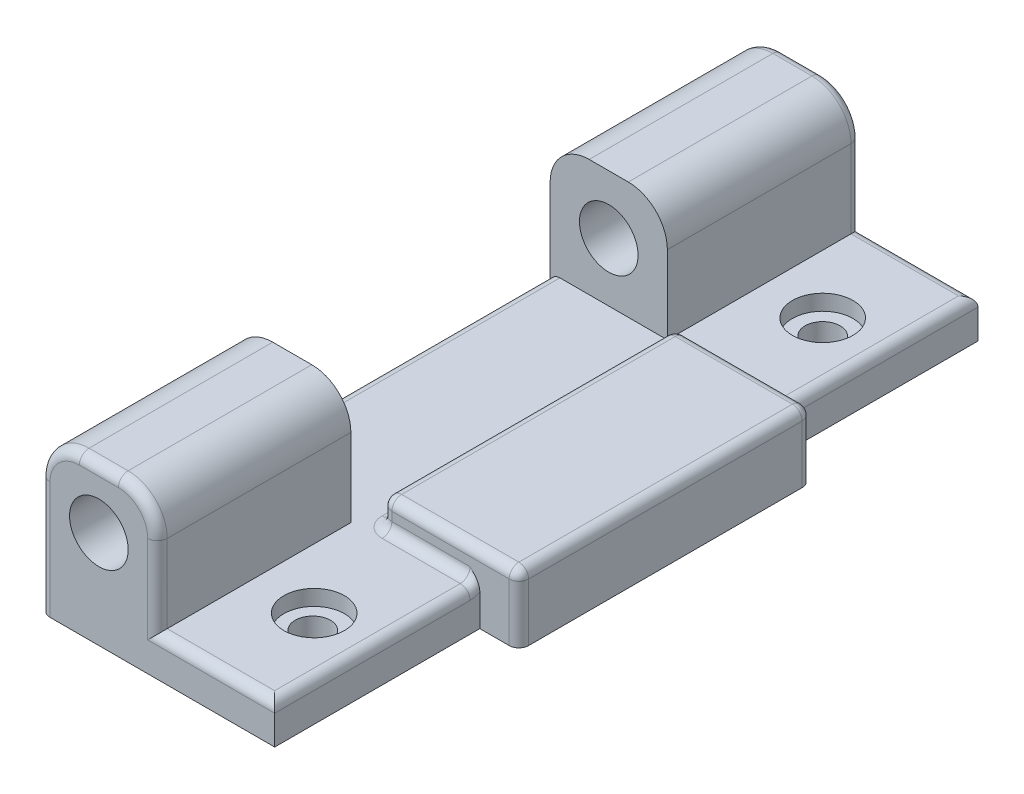
from build123d import *

# Parameters (mm, degrees)
SKETCH2_W             = 12
SKETCH2_H             = 36
BOSS_EXTRUDE1_DEPTH   = 2
SKETCH3_W             = 6
SKETCH3_H             = 9.9
BOSS_EXTRUDE2_DEPTH   = 6
F_3_0MM_DOWEL_HOLE1_D = 3
FILLET1_R             = 2
SKETCH10_W            = 15
SKETCH10_H            = 2
BOSS_EXTRUDE3_DEPTH   = 2
SKETCH11_W            = 7
SKETCH11_H            = 15
BOSS_EXTRUDE4_DEPTH   = 1.45
FILLET2_R             = 0.5
FILLET5_R             = 0.5
FILLET6_R             = 0.5
SKETCH7_R             = 0.9
CUT_EXTRUDE5_DEPTH    = 62.182196999
SKETCH19_R            = 1.55
CUT_EXTRUDE6_DEPTH    = 0.8
FILLET7_R             = 0.5


with BuildPart() as part:
    # Sketch2 → Boss-Extrude1 (new body)
    with BuildSketch(Plane(origin=(0, 0, 0), x_dir=(1, 0, 0), z_dir=(0, 1, 0))):
        with Locations((-48.387350108, 9.372931481)):
            Rectangle(SKETCH2_W, SKETCH2_H)
    extrude(amount=BOSS_EXTRUDE1_DEPTH)

    # Sketch3 → Boss-Extrude2 (add)
    with BuildSketch(Plane(origin=(0, 2, 0), x_dir=(1, 0, 0), z_dir=(0, 1, 0))):
        with Locations((-51.387350108, -3.677068519)):
            Rectangle(SKETCH3_W, SKETCH3_H)
        with Locations((-51.387350108, 22.422931481)):
            Rectangle(SKETCH3_W, SKETCH3_H)
    extrude(amount=BOSS_EXTRUDE2_DEPTH)

    # Ø3.0mm Dowel Hole1 (through all)
    with Locations(Plane(origin=(0, 0, -27.372931481), x_dir=(-1, 0, 0), z_dir=(0, 0, -1))):
        with Locations((51.387350108, 5)):
            Hole(F_3_0MM_DOWEL_HOLE1_D / 2)

    # Fillet1
    fillet1_edges = [part.edges().sort_by_distance(p)[0] for p in [
        (-54.387350108, 8, 3.677068519),
        (-48.387350108, 8, 3.677068519),
        (-54.387350108, 8, -22.422931481),
        (-48.387350108, 8, -22.422931481),
    ]]
    fillet(fillet1_edges, radius=FILLET1_R)

    # Sketch10 → Boss-Extrude3 (add)
    with BuildSketch(Plane(origin=(-42.387350108, 0, 0), x_dir=(0, 0, -1), z_dir=(1, 0, 0))):
        with Locations((9.372931481, 1)):
            Rectangle(SKETCH10_W, SKETCH10_H)
    extrude(amount=BOSS_EXTRUDE3_DEPTH)

    # Sketch11 → Boss-Extrude4 (add)
    with BuildSketch(Plane(origin=(0, 2, 0), x_dir=(1, 0, 0), z_dir=(0, 1, 0))):
        with Locations((-43.887350108, 9.372931481)):
            Rectangle(SKETCH11_W, SKETCH11_H)
    extrude(amount=BOSS_EXTRUDE4_DEPTH)

    # Fillet2
    fillet2_edges = [part.edges().sort_by_distance(p)[0] for p in [
        (-40.387350108, 1.725, -1.872931481),
        (-40.387350108, 1.725, -16.872931481),
        (-43.887350108, 3.45, -16.872931481),
        (-43.887350108, 3.45, -1.872931481),
    ]]
    fillet(fillet2_edges, radius=FILLET2_R)

    # Fillet5
    # the kernel refuses this fillet: 0.5 mm, written as the material it takes off along each edge
    with BuildSketch(Plane(origin=(-40.887350108, 2.95, -16.372931481), x_dir=(0, 1, 0), z_dir=(1, 0, 0))) as fillet5_piece_1_section:
        Polygon((0, 0), (FILLET5_R, 0), (FILLET5_R, -FILLET5_R), (0, -FILLET5_R), align=None)
    fillet5_piece_1 = extrude(amount=FILLET5_R, mode=Mode.PRIVATE)
    fillet5_piece_1 = fillet5_piece_1 - Plane(origin=(-40.887350108, 2.95, -16.372931481), x_dir=(0, -0.7071067811865475, 0.7071067811865475), z_dir=(1, 0, 0)) * Sphere(FILLET5_R, mode=Mode.PRIVATE)
    add(fillet5_piece_1, mode=Mode.SUBTRACT)
    with BuildSketch(Plane(origin=(-40.887350108, 2.95, -2.372931481), x_dir=(0, 1, 0), z_dir=(1, 0, 0))) as fillet5_piece_2_section:
        Polygon((0, 0), (FILLET5_R, 0), (FILLET5_R, FILLET5_R), (0, FILLET5_R), align=None)
    fillet5_piece_2 = extrude(amount=FILLET5_R, mode=Mode.PRIVATE)
    fillet5_piece_2 = fillet5_piece_2 - Plane(origin=(-40.887350108, 2.95, -2.372931481), x_dir=(0, -0.7071067811865477, -0.7071067811865474), z_dir=(1, 0, 0)) * Sphere(FILLET5_R, mode=Mode.PRIVATE)
    add(fillet5_piece_2, mode=Mode.SUBTRACT)
    with BuildSketch(Plane(origin=(-40.387350108, 3.45, -16.372931481), x_dir=(0, -1, 0), z_dir=(0, 0, 1))) as fillet5_piece_3:
        with BuildLine():
            CenterArc((FILLET5_R, -FILLET5_R), FILLET5_R, 90, 90)
            Line((0, -FILLET5_R), (0, 0))
            Line((0, 0), (FILLET5_R, 0))
        make_face()
    extrude(amount=14, mode=Mode.SUBTRACT)

    # Fillet6
    fillet6_edges = [part.edges().sort_by_distance(p)[0] for p in [
        (-47.387350108, 2.475, -16.872931481),
        (-47.387350108, 2.475, -1.872931481),
        (-47.387350108, 3.45, -9.372931481),
        (-47.387350108, 3.303553391, -2.01937809),
        (-47.387350108, 3.303553391, -16.726484871),
        (-44.887350108, 2, -16.872931481),
        (-47.387350108, 2, -9.372931481),
        (-44.887350108, 2, -1.872931481),
    ]]
    fillet(fillet6_edges, radius=FILLET6_R)

    # Sketch7 → Cut-Extrude5 (cut, through all)
    with BuildSketch(Plane(origin=(0, 2, 0), x_dir=(1, 0, 0), z_dir=(0, 1, 0))):
        with Locations(Location((-45.387350108, -3.677068519, 0), (0, 0, 270))):
            Circle(SKETCH7_R)
        with Locations(Location((-45.387350108, 22.422931481, 0), (0, 0, 270))):
            Circle(SKETCH7_R)
    extrude(amount=-CUT_EXTRUDE5_DEPTH, mode=Mode.SUBTRACT)

    # Sketch19 → Cut-Extrude6 (cut)
    with BuildSketch(Plane(origin=(0, 2, 0), x_dir=(1, 0, 0), z_dir=(0, 1, 0))):
        with Locations(Location((-45.316328349, -3.677068519, 0), (0, 0, 270))):
            Circle(SKETCH19_R)
        with Locations(Location((-45.387350108, 22.422931481, 0), (0, 0, 270))):
            Circle(SKETCH19_R)
    extrude(amount=-CUT_EXTRUDE6_DEPTH, mode=Mode.SUBTRACT)

    # Fillet7
    # the kernel refuses this fillet: 0.5 mm, written as the material it takes off along each edge
    with BuildSketch(Plane(origin=(-42.387350108, 2, -1.372931481), x_dir=(0, -1, 0), z_dir=(0, 0, 1)), Plane(origin=(-42.387350108, 2, -28.622931481), x_dir=(0, -1, 0), z_dir=(0, 0, 1))) as fillet7_piece_1:
        with BuildLine():
            CenterArc((FILLET7_R, -FILLET7_R), FILLET7_R, 90, 90)
            Line((0, -FILLET7_R), (0, 0))
            Line((0, 0), (FILLET7_R, 0))
        make_face()
    extrude(amount=11.25, mode=Mode.SUBTRACT)
    with BuildSketch(Plane(origin=(-41.137350108, 2, 8.627068519), x_dir=(0, -1, 0), z_dir=(-1, 0, 0)), Plane(origin=(-48.387350108, 2, -27.372931481), x_dir=(0, -1, 0), z_dir=(1, 0, 0)), Plane(origin=(-54.387350108, -1.25, 8.627068519), x_dir=(0, 0, -1), z_dir=(0, 1, 0)), Plane(origin=(-54.387350108, -1.25, -27.372931481), x_dir=(1, 0, 0), z_dir=(0, 1, 0))) as fillet7_piece_2:
        with BuildLine():
            CenterArc((FILLET7_R, -FILLET7_R), FILLET7_R, 90, 90)
            Line((0, -FILLET7_R), (0, 0))
            Line((0, 0), (FILLET7_R, 0))
        make_face()
    extrude(amount=7.25, mode=Mode.SUBTRACT)
    with BuildSketch(Plane(origin=(-42.387350108, 2.5, -17.372931481), x_dir=(0, 0.5976672776328271, -0.8017442392976486), z_dir=(0, -0.8017442392976486, -0.5976672776328271))) as fillet7_piece_3_section:
        with BuildLine():
            CenterArc((0.5 + FILLET7_R, -FILLET7_R), FILLET7_R, 90, 90)
            Line((0.5, -FILLET7_R), (0.5, 0))
            Line((0.5, 0), (0.5 + FILLET7_R, 0))
        make_face()
    fillet7_piece_3 = revolve(axis=Axis((-42.387350108, 2.5, -17.372931481), (1, 0, 0)), revolution_arc=233.296989237, mode=Mode.PRIVATE)
    fillet7_piece_3 = split(fillet7_piece_3, bisect_by=Plane(origin=(-42.387350108, 2.5, -16.872931481), z_dir=(0, 0, -1)), keep=Keep.TOP, mode=Mode.PRIVATE)
    add(fillet7_piece_3, mode=Mode.SUBTRACT)
    with BuildSketch(Plane(origin=(-42.387350108, 2.5, -1.372931481), x_dir=(0, -1, 0), z_dir=(0, 0, 1))) as fillet7_piece_4_section:
        with BuildLine():
            CenterArc((0.5 + FILLET7_R, -FILLET7_R), FILLET7_R, 90, 90)
            Line((0.5, -FILLET7_R), (0.5, 0))
            Line((0.5, 0), (0.5 + FILLET7_R, 0))
        make_face()
    fillet7_piece_4 = revolve(axis=Axis((-42.387350108, 2.5, -1.372931481), (1, 0, 0)), revolution_arc=233.296989237, mode=Mode.PRIVATE)
    fillet7_piece_4 = split(fillet7_piece_4, bisect_by=Plane(origin=(-42.387350108, 2.5, -1.872931481), z_dir=(0, 0, 1)), keep=Keep.TOP, mode=Mode.PRIVATE)
    add(fillet7_piece_4, mode=Mode.SUBTRACT)
    with BuildSketch(Plane(origin=(-54.387350108, 2, -1.272931481), x_dir=(0, -1, 0), z_dir=(0, 0, -1))) as fillet7_piece_5:
        with BuildLine():
            CenterArc((FILLET7_R, -FILLET7_R), FILLET7_R, 90, 90)
            Line((0, -FILLET7_R), (0, 0))
            Line((0, 0), (FILLET7_R, 0))
        make_face()
    extrude(amount=16.2, mode=Mode.SUBTRACT)
    with BuildSketch(Plane(origin=(-52.387350108, 8, -27.372931481), x_dir=(0, -1, 0), z_dir=(1, 0, 0))) as fillet7_piece_6:
        with BuildLine():
            CenterArc((FILLET7_R, -FILLET7_R), FILLET7_R, 90, 90)
            Line((0, -FILLET7_R), (0, 0))
            Line((0, 0), (FILLET7_R, 0))
        make_face()
    extrude(amount=2, mode=Mode.SUBTRACT)
    with BuildSketch(Plane(origin=(-48.387350108, 2, -27.372931481), x_dir=(-1, 0, 0), z_dir=(0, 1, 0))) as fillet7_piece_7:
        with BuildLine():
            CenterArc((FILLET7_R, FILLET7_R), FILLET7_R, 180, 90)
            Line((0, FILLET7_R), (0, 0))
            Line((0, 0), (FILLET7_R, 0))
        make_face()
    extrude(amount=4, mode=Mode.SUBTRACT)
    with BuildSketch(Plane(origin=(-50.387350108, 6, -27.372931481), x_dir=(0, 1, 0), z_dir=(-1, 0, 0))) as fillet7_piece_8:
        with BuildLine():
            CenterArc((2 - FILLET7_R, -FILLET7_R), FILLET7_R, 0, 90)
            Line((2, -FILLET7_R), (2, 0))
            Line((2, 0), (2 - FILLET7_R, 0))
        make_face()
    revolve(axis=Axis((-50.387350108, 6, -27.372931481), (0, 0, -1)), revolution_arc=90, mode=Mode.SUBTRACT)
    with BuildSketch(Plane(origin=(-52.387350108, 6, -27.372931481), x_dir=(-1, 0, 0), z_dir=(0, -1, 0))) as fillet7_piece_9:
        with BuildLine():
            CenterArc((2 - FILLET7_R, -FILLET7_R), FILLET7_R, 0, 90)
            Line((2, -FILLET7_R), (2, 0))
            Line((2, 0), (2 - FILLET7_R, 0))
        make_face()
    revolve(axis=Axis((-52.387350108, 6, -27.372931481), (0, 0, -1)), revolution_arc=90, mode=Mode.SUBTRACT)
    with BuildSketch(Plane(origin=(-52.387350108, 8, 8.627068519), x_dir=(0, -1, 0), z_dir=(1, 0, 0))) as fillet7_piece_10:
        with BuildLine():
            CenterArc((FILLET7_R, FILLET7_R), FILLET7_R, 180, 90)
            Line((0, FILLET7_R), (0, 0))
            Line((0, 0), (FILLET7_R, 0))
        make_face()
    extrude(amount=2, mode=Mode.SUBTRACT)
    with BuildSketch(Plane(origin=(-48.387350108, 2, 8.627068519), x_dir=(-1, 0, 0), z_dir=(0, 1, 0))) as fillet7_piece_11:
        with BuildLine():
            CenterArc((FILLET7_R, -FILLET7_R), FILLET7_R, 90, 90)
            Line((0, -FILLET7_R), (0, 0))
            Line((0, 0), (FILLET7_R, 0))
        make_face()
    extrude(amount=4, mode=Mode.SUBTRACT)
    with BuildSketch(Plane(origin=(-50.387350108, 6, 8.627068519), x_dir=(0, 1, 0), z_dir=(-1, 0, 0))) as fillet7_piece_12:
        with BuildLine():
            CenterArc((2 - FILLET7_R, FILLET7_R), FILLET7_R, 270, 90)
            Line((2, FILLET7_R), (2, 0))
            Line((2, 0), (2 - FILLET7_R, 0))
        make_face()
    revolve(axis=Axis((-50.387350108, 6, 8.627068519), (0, 0, -1)), revolution_arc=90, mode=Mode.SUBTRACT)
    with BuildSketch(Plane(origin=(-52.387350108, 6, 8.627068519), x_dir=(-1, 0, 0), z_dir=(0, -1, 0))) as fillet7_piece_13:
        with BuildLine():
            CenterArc((2 - FILLET7_R, FILLET7_R), FILLET7_R, 270, 90)
            Line((2, FILLET7_R), (2, 0))
            Line((2, 0), (2 - FILLET7_R, 0))
        make_face()
    revolve(axis=Axis((-52.387350108, 6, 8.627068519), (0, 0, -1)), revolution_arc=90, mode=Mode.SUBTRACT)
    with BuildSketch(Plane(origin=(-42.387350108, 2, 8.627068519), x_dir=(0, -1, 0), z_dir=(-1, 0, 0))) as fillet7_piece_14a_section:
        with BuildLine():
            CenterArc((FILLET7_R, -FILLET7_R), FILLET7_R, 90, 90)
            Line((0, -FILLET7_R), (0, 0))
            Line((0, 0), (FILLET7_R, 0))
        make_face()
    fillet7_piece_14a = extrude(amount=7.25, mode=Mode.PRIVATE)
    fillet7_piece_14a = split(fillet7_piece_14a, bisect_by=Plane(origin=(-48.387350108, 2, 8.627068519), z_dir=(-1, 0, 0)), keep=Keep.TOP, mode=Mode.PRIVATE)
    with BuildSketch(Plane(origin=(-48.387350108, 0.75, 8.627068519), x_dir=(-1, 0, 0), z_dir=(0, 1, 0))) as fillet7_piece_14b_section:
        with BuildLine():
            CenterArc((FILLET7_R, -FILLET7_R), FILLET7_R, 90, 90)
            Line((0, -FILLET7_R), (0, 0))
            Line((0, 0), (FILLET7_R, 0))
        make_face()
    fillet7_piece_14b = extrude(amount=5.25, mode=Mode.PRIVATE)
    fillet7_piece_14b = split(fillet7_piece_14b, bisect_by=Plane(origin=(-48.387350108, 2, 8.627068519), z_dir=(0, -1, 0)), keep=Keep.TOP, mode=Mode.PRIVATE)
    fillet7_piece_14 = fillet7_piece_14a & fillet7_piece_14b
    add(fillet7_piece_14, mode=Mode.SUBTRACT)
    with BuildSketch(Plane(origin=(-49.637350108, 2, -27.372931481), x_dir=(0, -1, 0), z_dir=(1, 0, 0))) as fillet7_piece_15a_section:
        with BuildLine():
            CenterArc((FILLET7_R, -FILLET7_R), FILLET7_R, 90, 90)
            Line((0, -FILLET7_R), (0, 0))
            Line((0, 0), (FILLET7_R, 0))
        make_face()
    fillet7_piece_15a = extrude(amount=7.25, mode=Mode.PRIVATE)
    fillet7_piece_15a = split(fillet7_piece_15a, bisect_by=Plane(origin=(-48.387350108, 2, -27.372931481), z_dir=(-1, 0, 0)), keep=Keep.TOP, mode=Mode.PRIVATE)
    with BuildSketch(Plane(origin=(-48.387350108, 0.75, -27.372931481), x_dir=(-1, 0, 0), z_dir=(0, 1, 0))) as fillet7_piece_15b_section:
        with BuildLine():
            CenterArc((FILLET7_R, FILLET7_R), FILLET7_R, 180, 90)
            Line((0, FILLET7_R), (0, 0))
            Line((0, 0), (FILLET7_R, 0))
        make_face()
    fillet7_piece_15b = extrude(amount=5.25, mode=Mode.PRIVATE)
    fillet7_piece_15b = split(fillet7_piece_15b, bisect_by=Plane(origin=(-48.387350108, 2, -27.372931481), z_dir=(0, -1, 0)), keep=Keep.TOP, mode=Mode.PRIVATE)
    fillet7_piece_15 = fillet7_piece_15a & fillet7_piece_15b
    add(fillet7_piece_15, mode=Mode.SUBTRACT)


solid = part.part
